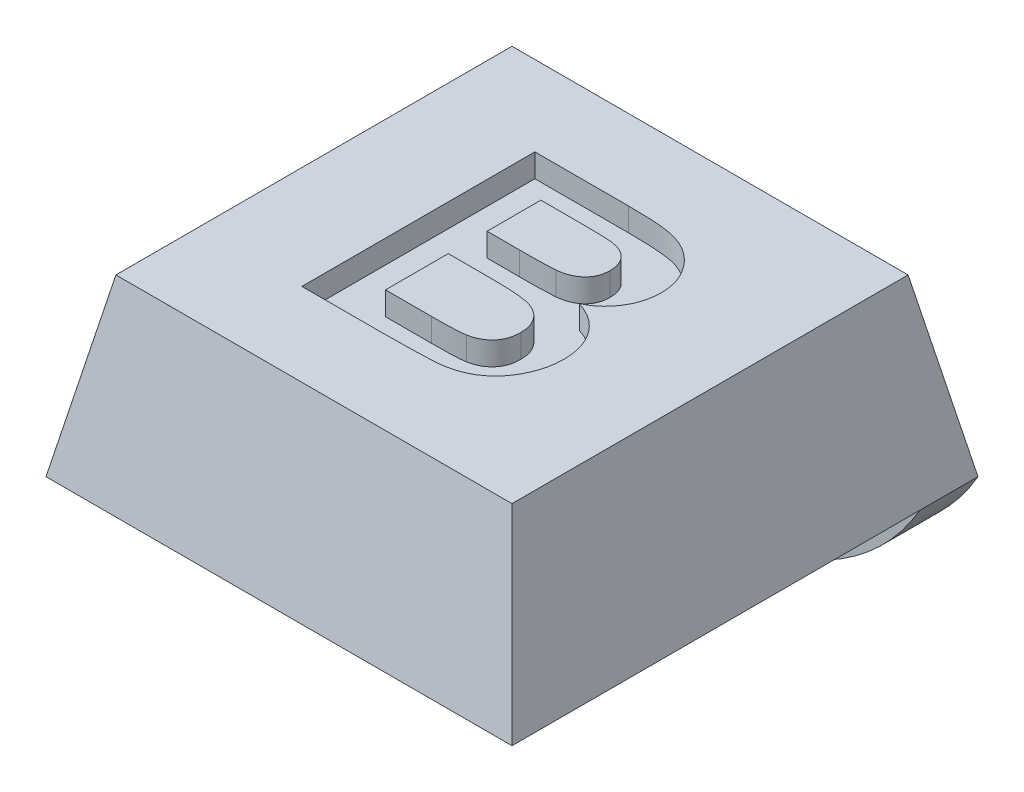
from build123d import *

# Parameters (mm, degrees)
SKETCH1_W               = 8
SKETCH1_H               = 8
BOSS_EXTRUDE1_DEPTH     = 3
CUT_EXTRUDE1_DEPTH      = 12.704699911
CUT_EXTRUDE1_DEPTH_BACK = 12.704699911
CUT_EXTRUDE2_DEPTH      = 11
SKETCH4_R               = 1.8
CUT_EXTRUDE3_DEPTH      = 0.8
SKETCH5_W               = 8
SKETCH5_H               = 1
BOSS_EXTRUDE2_DEPTH     = 2
FILLET1_R               = 4
CUT_EXTRUDE4_DEPTH      = 0.4


with BuildPart() as part:
    # Sketch1 → Boss-Extrude1 (new body)
    with BuildSketch(Plane(origin=(0, 0, 0), x_dir=(1, 0, 0), z_dir=(0, 1, 0))):
        with Locations((4, 4)):
            Rectangle(SKETCH1_W, SKETCH1_H)
    extrude(amount=BOSS_EXTRUDE1_DEPTH)

    # Sketch2 → Cut-Extrude1 (cut, two sides: drawn at the far end of the back side and taken through both)
    with BuildSketch(Plane.XY.offset(-CUT_EXTRUDE1_DEPTH_BACK)):
        Polygon((0, 0), (0.6, 3), (0, 3), align=None)
        Polygon((8, 0), (7.4, 3), (8, 3), align=None)
    extrude(amount=CUT_EXTRUDE1_DEPTH + CUT_EXTRUDE1_DEPTH_BACK, mode=Mode.SUBTRACT)

    # Sketch3 → Cut-Extrude2 (cut)
    with BuildSketch(Plane(origin=(0, 0, 0), x_dir=(0, 0, -1), z_dir=(1, 0, 0))):
        Polygon((0, 0), (0.6, 3), (0, 3), align=None)
        Polygon((8, 3), (7.4, 3), (8, 0), align=None)
    extrude(amount=CUT_EXTRUDE2_DEPTH, mode=Mode.SUBTRACT)

    # Sketch4 → Cut-Extrude3 (cut)
    with BuildSketch(Plane.XZ):
        with Locations(Location((4, -3.75, 0), (0, 0, 270))):
            Circle(SKETCH4_R)
    extrude(amount=-CUT_EXTRUDE3_DEPTH, mode=Mode.SUBTRACT)

    # Sketch5 → Boss-Extrude2 (add)
    with BuildSketch(Plane.XZ):
        with Locations((4, -7.5)):
            Rectangle(SKETCH5_W, SKETCH5_H)
    extrude(amount=BOSS_EXTRUDE2_DEPTH)

    # Fillet1
    # the kernel refuses this fillet: 4 mm, written as the material it takes off along each edge
    with BuildSketch(Plane(origin=(8, -2, -16.660254038), x_dir=(0, 1, 0), z_dir=(0, 0, 1)), Plane(origin=(0, -2, 1.660254038), x_dir=(0, 1, 0), z_dir=(0, 0, -1))) as fillet1_piece_1:
        with BuildLine():
            CenterArc((4, 3.464101615), FILLET1_R, 180, 60)
            Line((0, 3.464101615), (-0.08, 3.464101615))
            Line((-0.08, 3.464101615), (-0.08, 0))
            Line((-0.08, 0), (0, -0.08))
            ThreePointArc((0, -0.08), (1, -0.08), (1.96, -0.069282032))
            Line((1.96, -0.069282032), (2, 0))
        make_face()
    extrude(amount=18.320508076, mode=Mode.SUBTRACT)

    # Sketch6 → Cut-Extrude4 (cut)
    with BuildSketch(Plane(origin=(0, 3, 0), x_dir=(1, 0, 0), z_dir=(0, 1, 0))):
        with BuildLine():
            Line((2.366875023, 6.025988971), (3.978253228, 6.025988971))
            add(Edge.make_bspline(
                [(3.978253228, 6.025988971), (4.016981522, 6.025758539), (4.091770291, 6.025313549), (4.200234262, 6.02407341), (4.300910244, 6.020431423), (4.393955008, 6.01730407), (4.479059098, 6.009990491), (4.556891378, 6.004244483), (4.627206795, 5.996339471), (4.710040188, 5.983546816), (4.806360793, 5.963648743), (4.915152558, 5.926842691), (5.018276483, 5.880857129), (5.114182519, 5.822393524), (5.203189243, 5.754016663), (5.28597738, 5.676271174), (5.358728101, 5.58601543), (5.424238976, 5.487508268), (5.479534837, 5.380666952), (5.517612886, 5.26572697), (5.541913225, 5.144795761), (5.544858568, 5.061898711), (5.546362202, 5.019578715)],
                knots=[0, 0, 0, 0, 1.096610875, 2.117681168, 3.071055591, 3.949137991, 4.753059115, 5.489127199, 6.15892391, 6.75575099, 7.862330316, 8.938514814, 10.001276227, 11.05313779, 12.110449801, 13.174958802, 14.260456508, 15.384725817, 16.521138801, 17.654729897, 18.802709851, 20, 20, 20, 20], degree=3))
            add(Edge.make_bspline(
                [(5.546362202, 5.019578715), (5.544802721, 4.973493311), (5.541727769, 4.882623117), (5.513106772, 4.749371009), (5.467516851, 4.621879661), (5.40315043, 4.502217288), (5.324314646, 4.392405777), (5.231065087, 4.295977947), (5.12477188, 4.213520097), (5.044958184, 4.17248881), (5.004695536, 4.151790253)],
                knots=[0, 0, 0, 0, 1.023065178, 2.01725758, 3.014298905, 4.023406433, 5.026736079, 6.009055718, 6.99565244, 8, 8, 8, 8], degree=3))
            add(Edge.make_bspline(
                [(5.004695536, 4.151790253), (5.0318132, 4.142553707), (5.085431798, 4.12429068), (5.162178571, 4.090754541), (5.234086142, 4.051862796), (5.301118401, 4.008841827), (5.363784101, 3.961377137), (5.420252395, 3.907894911), (5.473763466, 3.851437899), (5.520742036, 3.789172127), (5.563264851, 3.724075672), (5.599360366, 3.65512964), (5.630616076, 3.583992364), (5.656755805, 3.509943884), (5.675388869, 3.432487562), (5.69031884, 3.352599145), (5.697956597, 3.269724954), (5.699451608, 3.213768347), (5.700208356, 3.185444099)],
                knots=[0, 0, 0, 0, 1.072651974, 2.1209089, 3.132484228, 4.131466326, 5.101889999, 6.071643115, 7.041396231, 8.011819904, 8.988565287, 9.95070344, 10.922775742, 11.897213062, 12.887138018, 13.903598663, 14.938838629, 16, 16, 16, 16], degree=3))
            add(Edge.make_bspline(
                [(5.700208356, 3.185444099), (5.698598844, 3.140212221), (5.695387249, 3.049957264), (5.671387404, 2.915316113), (5.630853991, 2.783046233), (5.575963383, 2.654005704), (5.507783193, 2.532330941), (5.427626978, 2.4212421), (5.334105775, 2.324584109), (5.230539132, 2.239414342), (5.113835126, 2.16890592), (4.984093466, 2.114745557), (4.842134035, 2.073828468), (4.742124288, 2.060236169), (4.690592972, 2.053232561)],
                knots=[0, 0, 0, 0, 0.975059807, 1.945618526, 2.93861228, 3.952760547, 4.963632603, 5.940527786, 6.897802811, 7.855787948, 8.824773195, 9.82606706, 10.879852914, 12, 12, 12, 12], degree=3))
            add(Edge.make_bspline(
                [(4.690592972, 2.053232561), (4.670833027, 2.051565703), (4.625472552, 2.047739302), (4.548543711, 2.042982046), (4.453955886, 2.039386091), (4.341791209, 2.035134329), (4.211704387, 2.032064432), (4.063991072, 2.029968108), (3.898399223, 2.027247493), (3.782207382, 2.026423), (3.72104169, 2.025988971)],
                knots=[0, 0, 0, 0, 0.490565993, 1.126131979, 1.906526787, 2.832178623, 3.902933831, 5.125497984, 6.486805064, 8, 8, 8, 8], degree=3))
            Line((3.72104169, 2.025988971), (2.366875023, 2.025988971))
            Line((2.366875023, 2.025988971), (2.366875023, 6.025988971))
        make_face()
        with BuildLine():
            Line((3.136105792, 5.359322304), (3.136105792, 4.436245381))
            Line((3.136105792, 4.436245381), (3.692996818, 4.436245381))
            add(Edge.make_bspline(
                [(3.692996818, 4.436245381), (3.732259986, 4.43615888), (3.807047978, 4.435994114), (3.91334909, 4.43709824), (4.008173732, 4.437613694), (4.091249283, 4.439126475), (4.162558686, 4.441623123), (4.221845003, 4.444116229), (4.269450826, 4.446003799), (4.297170592, 4.448699163), (4.309182715, 4.449867176)],
                knots=[0, 0, 0, 0, 1.528479216, 2.911428072, 4.138414629, 5.21998762, 6.145918986, 6.915989543, 7.530253335, 8, 8, 8, 8], degree=3))
            add(Edge.make_bspline(
                [(4.309182715, 4.449867176), (4.3438238, 4.455079871), (4.41040184, 4.465098351), (4.503567155, 4.494454854), (4.584375726, 4.536913614), (4.653724553, 4.58976356), (4.708773054, 4.654604252), (4.749170144, 4.72919452), (4.772805412, 4.813847791), (4.775653451, 4.873327339), (4.777131433, 4.904194099)],
                knots=[0, 0, 0, 0, 1.162079002, 2.233444551, 3.225172046, 4.179556897, 5.110707885, 6.027301426, 6.976273101, 8, 8, 8, 8], degree=3))
            add(Edge.make_bspline(
                [(4.777131433, 4.904194099), (4.776203651, 4.934000177), (4.774422539, 4.991220438), (4.752297006, 5.072236392), (4.719032932, 5.144995211), (4.670409719, 5.207709385), (4.609395094, 5.260672186), (4.534716376, 5.302043411), (4.446732173, 5.330510733), (4.38335661, 5.340467498), (4.3500481, 5.345700509)],
                knots=[0, 0, 0, 0, 1.044241546, 2.004684189, 2.928111627, 3.838334562, 4.769594837, 5.748424953, 6.81663206, 8, 8, 8, 8], degree=3))
            add(Edge.make_bspline(
                [(4.3500481, 5.345700509), (4.336967148, 5.34687206), (4.306041436, 5.349641817), (4.252292165, 5.35144236), (4.183926257, 5.353976507), (4.100595234, 5.356449705), (4.002296842, 5.357959731), (3.889310645, 5.358468661), (3.761641688, 5.359577608), (3.671629596, 5.359410545), (3.624086561, 5.359322304)],
                knots=[0, 0, 0, 0, 0.433943041, 1.02591908, 1.776648879, 2.694999143, 3.780816848, 5.02540149, 6.428861738, 8, 8, 8, 8], degree=3))
            Line((3.624086561, 5.359322304), (3.136105792, 5.359322304))
        make_face(mode=Mode.SUBTRACT)
        with BuildLine():
            Line((3.136105792, 3.769578715), (3.136105792, 2.692655638))
            Line((3.136105792, 2.692655638), (3.921362202, 2.692655638))
            add(Edge.make_bspline(
                [(3.921362202, 2.692655638), (3.957955896, 2.692474114), (4.027408125, 2.692129595), (4.126486109, 2.694437139), (4.214933064, 2.69519802), (4.293162962, 2.698994102), (4.360764719, 2.701865798), (4.418016495, 2.705445849), (4.464471269, 2.711139165), (4.491885355, 2.715559172), (4.503894254, 2.717495381)],
                knots=[0, 0, 0, 0, 1.504773752, 2.85595359, 4.075347731, 5.141676974, 6.076328919, 6.858106537, 7.499786952, 8, 8, 8, 8], degree=3))
            add(Edge.make_bspline(
                [(4.503894254, 2.717495381), (4.534390702, 2.723929926), (4.593642924, 2.736431746), (4.675765739, 2.772305806), (4.749780788, 2.817800627), (4.813883543, 2.876271003), (4.866572685, 2.946316906), (4.904617992, 3.02809262), (4.927561873, 3.120636015), (4.929805566, 3.185839411), (4.930977587, 3.219899227)],
                knots=[0, 0, 0, 0, 1.031056579, 2.003262591, 2.954260215, 3.900917722, 4.862741126, 5.841340256, 6.872396835, 8, 8, 8, 8], degree=3))
            add(Edge.make_bspline(
                [(4.930977587, 3.219899227), (4.930031736, 3.249108452), (4.928190747, 3.305960799), (4.910169932, 3.38739087), (4.88101832, 3.461844609), (4.840421058, 3.528813936), (4.789699747, 3.589139928), (4.726998003, 3.639624345), (4.654607383, 3.681685756), (4.585597801, 3.709395341), (4.520158829, 3.72717269), (4.457743787, 3.73883498), (4.382520906, 3.748066566), (4.294854864, 3.755875466), (4.194389919, 3.762120128), (4.081396073, 3.767043008), (3.95555801, 3.769103428), (3.867409493, 3.769415255), (3.821201946, 3.769578715)],
                knots=[0, 0, 0, 0, 0.992165387, 1.931134082, 2.820086661, 3.700270762, 4.583075858, 5.486803518, 6.423132184, 7.421722103, 8.005700193, 8.727213115, 9.57900282, 10.582332745, 11.720121093, 13.002085041, 14.428489784, 16, 16, 16, 16], degree=3))
            Line((3.821201946, 3.769578715), (3.136105792, 3.769578715))
        make_face(mode=Mode.SUBTRACT)
    extrude(amount=-CUT_EXTRUDE4_DEPTH, mode=Mode.SUBTRACT)


solid = part.part
